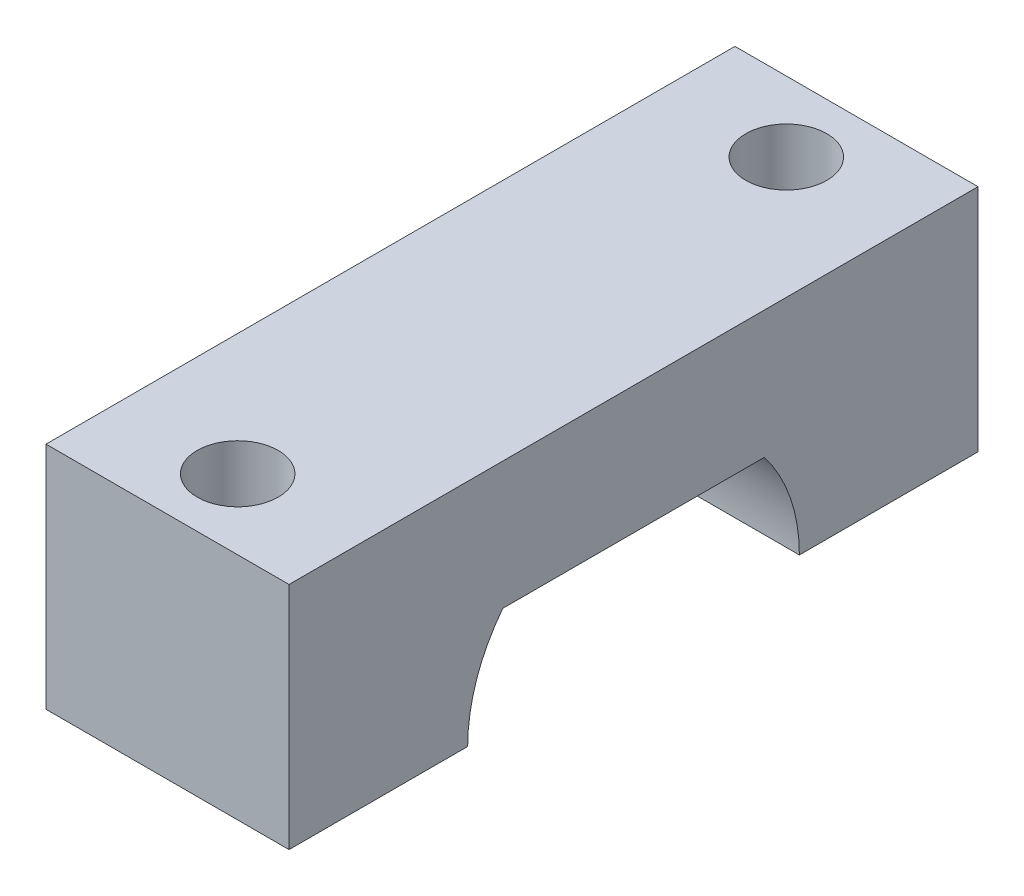
from build123d import *

# Parameters (mm, degrees)
BOSS_EXTRUDE1_DEPTH = 9.525
SKETCH2_R           = 1.5875
CUT_EXTRUDE1_DEPTH  = 19.814239953


with BuildPart() as part:
    # Sketch1 → Boss-Extrude1 (new body)
    with BuildSketch(Plane(origin=(0, 0, 0), x_dir=(0, 0, -1), z_dir=(1, 0, 0))):
        with BuildLine():
            Line((-6.5, 0), (-13.5, 0))
            Line((-13.5, 0), (-13.5, 9))
            Line((-13.5, 9), (13.5, 9))
            Line((13.5, 9), (13.5, 0))
            Line((13.5, 0), (6.5, 0))
            ThreePointArc((6.5, 0), (6.146242348, 2.115113473), (5.123475383, 4))
            Line((5.123475383, 4), (-5.123475383, 4))
            ThreePointArc((-5.123475383, 4), (-6.146242348, 2.115113473), (-6.5, 0))
        make_face()
    extrude(amount=BOSS_EXTRUDE1_DEPTH)

    # Sketch2 → Cut-Extrude1 (cut, through all)
    with BuildSketch(Plane(origin=(0, 9, 0), x_dir=(1, 0, 0), z_dir=(0, 1, 0))):
        with Locations((4.7625, -10.75)):
            Circle(SKETCH2_R)
        with Locations((4.7625, 10.75)):
            Circle(SKETCH2_R)
    extrude(amount=-CUT_EXTRUDE1_DEPTH, mode=Mode.SUBTRACT)


solid = part.part
